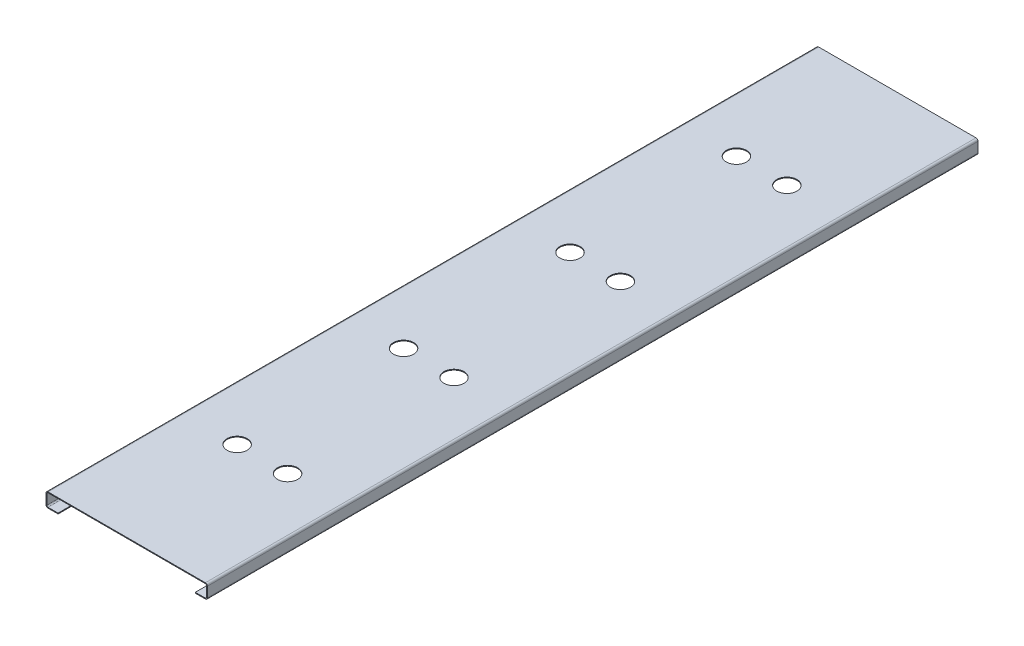
from build123d import *

# Parameters (mm, degrees)
BASE_FLANGE1_DEPTH = 764
SKETCH6_R          = 10
CUT_EXTRUDE1_DEPTH = 10


# Sheet-metal steps are written as plain solids
with BuildPart() as part:
    # Sketch1 → Base-Flange1 (new body)
    with BuildSketch(Plane.XY):
        with BuildLine():
            Line((12, 0), (2, 0))
            ThreePointArc((2, 0), (0.585786438, 0.585786438), (0, 2))
            Line((0, 2), (0, 12))
            ThreePointArc((0, 12), (0.585786438, 13.414213562), (2, 14))
            Line((2, 14), (158, 14))
            ThreePointArc((158, 14), (159.414213562, 13.414213562), (160, 12))
            Line((160, 12), (160, 2))
            ThreePointArc((160, 2), (159.414213562, 0.585786438), (158, 0))
            Line((158, 0), (148, 0))
            Line((148, 0), (148, 0.8))
            Line((148, 0.8), (158, 0.8))
            ThreePointArc((158, 0.8), (158.848528137, 1.151471863), (159.2, 2))
            Line((159.2, 2), (159.2, 12))
            ThreePointArc((159.2, 12), (158.848528137, 12.848528137), (158, 13.2))
            Line((158, 13.2), (2, 13.2))
            ThreePointArc((2, 13.2), (1.151471863, 12.848528137), (0.8, 12))
            Line((0.8, 12), (0.8, 2))
            ThreePointArc((0.8, 2), (1.151471863, 1.151471863), (2, 0.8))
            Line((2, 0.8), (12, 0.8))
            Line((12, 0.8), (12, 0))
        make_face()
    extrude(amount=BASE_FLANGE1_DEPTH)

    # Sketch6 → Cut-Extrude1 (cut)
    with BuildSketch(Plane(origin=(0, 14, 0), x_dir=(1, 0, 0), z_dir=(0, 1, 0))):
        with Locations(Location((105, -299.5, 0), (0, 0, 270))):
            Circle(SKETCH6_R)
        with Locations(Location((105, -134.5, 0), (0, 0, 270))):
            Circle(SKETCH6_R)
        with Locations(Location((105, -464.5, 0), (0, 0, 270))):
            Circle(SKETCH6_R)
        with Locations(Location((105, -629.5, 0), (0, 0, 270))):
            Circle(SKETCH6_R)
        with Locations(Location((55, -629.5, 0), (0, 0, 270))):
            Circle(SKETCH6_R)
        with Locations(Location((55, -464.5, 0), (0, 0, 270))):
            Circle(SKETCH6_R)
        with Locations(Location((55, -299.5, 0), (0, 0, 270))):
            Circle(SKETCH6_R)
        with Locations(Location((55, -134.5, 0), (0, 0, 270))):
            Circle(SKETCH6_R)
    extrude(amount=-CUT_EXTRUDE1_DEPTH, mode=Mode.SUBTRACT)


solid = part.part
